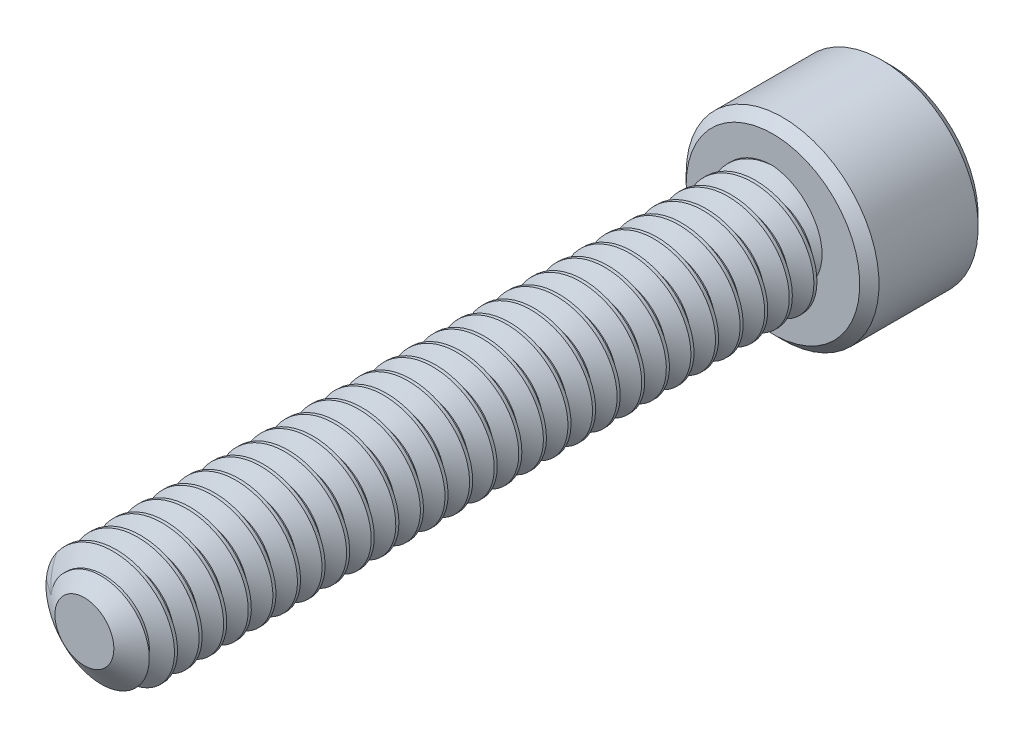
from build123d import *

# Parameters (mm, degrees)
SKETCH1_R          = 1.0922
EXTRUDE1_DEPTH     = 12.7
CUT_SWEEP1_PITCH   = 0.453571429
SKETCH6_R          = 1.778
EXTRUDE2_DEPTH     = 2.1844
CUT_EXTRUDE1_DEPTH = 1.48828125
CHAMFER1_SIZE      = 0.1778


with BuildPart() as part:
    # Sketch1 → Extrude1 (new body)
    with BuildSketch(Plane.XY):
        Circle(SKETCH1_R)
    extrude(amount=-EXTRUDE1_DEPTH)

    # Cut-Sweep1: the profile of Sketch3 profile screwed along a right-hand helix of 29 turns, 6 arcs to a turn; built about Z, then put on its axis
    cut_sweep1_z = Axis((0, 0, 0), (0, 0, 1))
    cut_sweep1_corners = [(1.0925, 0, -0.397048205), (0.797596715, 0, -0.226785714), (0.797596715, 0, -0.170089286), (1.0925, 0, 0.000173205)]
    with BuildLine(mode=Mode.PRIVATE) as cut_sweep1_profile:
        Line(cut_sweep1_corners[0], cut_sweep1_corners[1])
        Line(cut_sweep1_corners[1], cut_sweep1_corners[2])
        Line(cut_sweep1_corners[2], cut_sweep1_corners[3])
        Line(cut_sweep1_corners[3], cut_sweep1_corners[0])
    cut_sweep1_cap = Face(cut_sweep1_profile.wire())
    cut_sweep1_turn_angles = [0, 30, 60, 90, 120, 150, 180, 210, 240, 270, 300, 330, 360]
    cut_sweep1_turn_weights = [1, 0.8660254037844387, 1, 0.8660254037844387, 1, 0.8660254037844387, 1, 0.8660254037844387, 1, 0.8660254037844387, 1, 0.8660254037844387, 1]
    cut_sweep1_turn_rails = [Edge.make_bspline([Vector(p[0], p[1], 0).rotate(cut_sweep1_z, cut_sweep1_turn_angles[k]) / cut_sweep1_turn_weights[k] + Vector(0, 0, p[2] + CUT_SWEEP1_PITCH * cut_sweep1_turn_angles[k] / 360) for k in range(13)], [0, 0, 0, 1, 1, 2, 2, 3, 3, 4, 4, 5, 5, 6, 6, 6], 2, cut_sweep1_turn_weights) for p in cut_sweep1_corners]
    cut_sweep1_turn_sides = [Face.make_surface_from_curves(cut_sweep1_turn_rails[p[0]], cut_sweep1_turn_rails[p[1]]) for p in [(0, 1), (1, 2), (2, 3), (3, 0)]]
    cut_sweep1 = Plane(origin=(0, 0, 0), x_dir=(0, 1, 0), z_dir=(0, 0, -1)) * Solid(Shell([*[p.moved(Location((0, 0, CUT_SWEEP1_PITCH * i))) for i in range(29) for p in cut_sweep1_turn_sides], cut_sweep1_cap, cut_sweep1_cap.rotate(cut_sweep1_z, 10440).moved(Location((0, 0, CUT_SWEEP1_PITCH * 10440 / 360)))]))
    add(cut_sweep1, mode=Mode.SUBTRACT)

    # Sketch4 → Cut-Revolve1 (revolve, cut)
    with BuildSketch(Plane(origin=(0, 0, 0), x_dir=(0, 0, -1), z_dir=(1, 0, 0)), mode=Mode.PRIVATE) as cut_revolve1_sk:
        Polygon((0.384136155, 1.0922), (0, 0.543596715), (0, 1.0922), align=None)
    revolve(cut_revolve1_sk.sketch.rotate(Axis((0, 0, 0), (0, 0, -1)), 275.894515937), axis=Axis((0, 0, 0), (0, 0, -1)), mode=Mode.SUBTRACT)

    # Sketch6 → Extrude2 (add)
    with BuildSketch(Plane(origin=(0, 0, -12.7), x_dir=(-1, 0, 0), z_dir=(0, 0, -1))):
        Circle(SKETCH6_R)
    extrude(amount=EXTRUDE2_DEPTH)

    # Sketch7 → Cut-Extrude1 (cut)
    with BuildSketch(Plane(origin=(0, 0, -14.8844), x_dir=(-1, 0, 0), z_dir=(0, 0, -1))):
        Polygon((0, 1.14567944), (-0.9921875, 0.57283972), (-0.9921875, -0.57283972), (0, -1.14567944), (0.9921875, -0.57283972), (0.9921875, 0.57283972), align=None)
    extrude(amount=-CUT_EXTRUDE1_DEPTH, mode=Mode.SUBTRACT)

    # Cut-Extrude2 cone 1 section (through the dimple's axis) → Cut-Extrude2 (revolve, cut)
    with BuildSketch(Plane(origin=(0, 0, -14.8844), x_dir=(0, 1, 0), z_dir=(1, 0, 0))):
        Polygon((0, 0), (1.14567944, 0), (0, 1.14567944), align=None)
    revolve(axis=Axis((0, 0, -14.8844), (0, 0, 1)), mode=Mode.SUBTRACT)

    # Chamfer1
    chamfer1_edges = [part.edges().sort_by_distance(p)[0] for p in [
        (1.778, 0, -12.7),
        (1.778, 0, -14.8844),
    ]]
    chamfer(chamfer1_edges, length=CHAMFER1_SIZE)


solid = part.part
